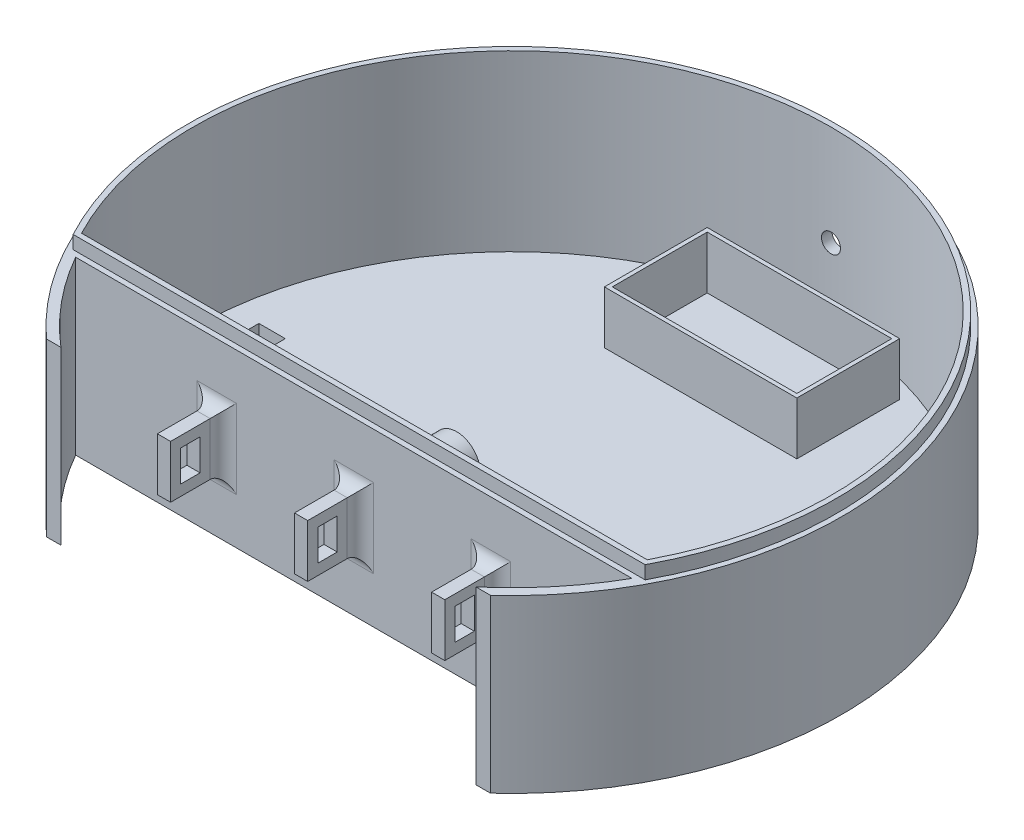
from build123d import *

# Parameters (mm, degrees)
RESSALTO_EXTRUS_O1_DEPTH   = 70
RESSALTO_EXTRUS_O4_START   = -70
RESSALTO_EXTRUS_O4_DEPTH   = 70
CASCA1_START               = 4
CASCA1_DEPTH               = 66
ESBO_O17_W                 = 10
ESBO_O17_H                 = 28
CORTE_EXTRUS_O2_DEPTH      = 10
CORTE_EXTRUS_O6_DEPTH      = 4
CORTE_EXTRUS_O6_DEPTH_BACK = 5
ESBO_O23_OUTSIDE_W         = 319.722
ESBO_O23_OUTSIDE_H         = 287.109
ESBO_O27_W                 = 5
ESBO_O27_H                 = 20
RESSALTO_EXTRUS_O5_DEPTH   = 20
FILETE2_R                  = 5
CORTE_EXTRUS_O7_DEPTH      = 104
CORTE_EXTRUS_O7_DEPTH_BACK = 5
ESBO_O28_W                 = 7.367994206
ESBO_O28_H                 = 11.845430552
ESBO_O32_R                 = 3.6
CORTE_EXTRUS_O8_DEPTH      = 187
ESBO_O32_3_R               = 9
ESBO_O32_3_R_2             = 3.6
RESSALTO_EXTRUS_O6_DEPTH   = 35
ESBO_O32_4_R               = 3.6
RESSALTO_EXTRUS_O7_DEPTH   = 6
FILETE3_R                  = 10
ESBO_O24_W                 = 73
ESBO_O24_H                 = 39
ESBO_O24_W_2               = 70
ESBO_O24_H_2               = 36
RESSALTO_EXTRUS_O8_DEPTH   = 20


# Read off the part's stored shape, not the designer's step: Casca1
with BuildPart() as part:
    # Esboço1 → Ressalto-extrusão1 (new body)
    with BuildSketch(Plane(origin=(0, 0, 0), x_dir=(1, 0, 0), z_dir=(0, 1, 0))):
        with BuildLine():
            ThreePointArc((125, 0), (-30.965140685, 121.103922572), (-109.658560997, -60))
            Line((-109.658560997, -60), (109.658560997, -60))
            ThreePointArc((109.658560997, -60), (121.103922572, -30.965140685), (125, 0))
        make_face()
    extrude(amount=RESSALTO_EXTRUS_O1_DEPTH)

    # Esboço5 → Ressalto-extrusão4 (add)
    with BuildSketch(Plane(origin=(0, 70, 0), x_dir=(1, 0, 0), z_dir=(0, 1, 0)).offset(RESSALTO_EXTRUS_O4_START)):
        with BuildLine():
            Line((-84.200220254, -92.386811338), (-78.700220254, -92.386811338))
            ThreePointArc((-78.700220254, -92.386811338), (-93.51006265, -77.362237302), (-105.49430116, -60))
            Line((-105.49430116, -60), (-109.658560997, -60))
            ThreePointArc((-109.658560997, -60), (-98.272748787, -77.249380877), (-84.200220254, -92.386811338))
        make_face()
        with BuildLine():
            Line((78.700220254, -92.386811338), (84.200220254, -92.386811338))
            ThreePointArc((84.200220254, -92.386811338), (98.272748787, -77.249380877), (109.658560997, -60))
            Line((109.658560997, -60), (105.49430116, -60))
            ThreePointArc((105.49430116, -60), (93.51006265, -77.362237302), (78.700220254, -92.386811338))
        make_face()
    extrude(amount=RESSALTO_EXTRUS_O4_DEPTH)

    # Casca1 outline → Casca1 (cut)
    with BuildSketch(Plane(origin=(0, 0, 0), x_dir=(1, 0, 0), z_dir=(0, 1, 0)).offset(CASCA1_START)):
        with BuildLine():
            Line((-107.261363034, -56), (107.261363034, -56))
            ThreePointArc((107.261363034, -56), (0, 121), (-107.261363034, -56))
        make_face()
    extrude(amount=CASCA1_DEPTH, mode=Mode.SUBTRACT)

    # Esboço17 → Corte-extrusão2 (cut)
    with BuildSketch(Plane(origin=(0, 4, 0), x_dir=(1, 0, 0), z_dir=(0, 1, 0))):
        with Locations((-105, 0)):
            Rectangle(ESBO_O17_W, ESBO_O17_H)
        with Locations((105, 0)):
            Rectangle(ESBO_O17_W, ESBO_O17_H)
    extrude(amount=-CORTE_EXTRUS_O2_DEPTH, mode=Mode.SUBTRACT)

    # Esboço23 outside → Corte-extrusão6 (cut, two sides: drawn at the far end of the back side and taken through both)
    with BuildSketch(Plane(origin=(0, 70, 0), x_dir=(1, 0, 0), z_dir=(0, 1, 0)).offset(-CORTE_EXTRUS_O6_DEPTH_BACK)):
        with Locations((0, 16.3065)):
            Rectangle(ESBO_O23_OUTSIDE_W, ESBO_O23_OUTSIDE_H)
        with BuildLine():
            Line((-108.466584716, -58), (108.466584716, -58))
            ThreePointArc((108.466584716, -58), (0, 123), (-108.466584716, -58))
        make_face(mode=Mode.SUBTRACT)
    extrude(amount=CORTE_EXTRUS_O6_DEPTH + CORTE_EXTRUS_O6_DEPTH_BACK, mode=Mode.SUBTRACT)

    # Esboço27 → Ressalto-extrusão5 (add)
    with BuildSketch(Plane.XY.offset(60)):
        with Locations((-52, 32.5)):
            Rectangle(ESBO_O27_W, ESBO_O27_H)
        with Locations((52, 32.5)):
            Rectangle(ESBO_O27_W, ESBO_O27_H)
        with Locations((0, 32.5)):
            Rectangle(ESBO_O27_W, ESBO_O27_H)
    extrude(amount=RESSALTO_EXTRUS_O5_DEPTH)

    # Filete2
    filete2_edges = [part.edges().sort_by_distance(p)[0] for p in [
        (-54.5, 32.5, 60),
        (-52, 22.5, 60),
        (-49.5, 32.5, 60),
        (-52, 42.5, 60),
        (49.5, 32.5, 60),
        (52, 22.5, 60),
        (54.5, 32.5, 60),
        (52, 42.5, 60),
        (-2.5, 32.5, 60),
        (0, 22.5, 60),
        (2.5, 32.5, 60),
        (0, 42.5, 60),
    ]]
    fillet(filete2_edges, radius=FILETE2_R)

    # Esboço28 → Corte-extrusão7 (cut, two sides: drawn at the far end of the back side and taken through both)
    with BuildSketch(Plane(origin=(-49.5, 0, 0), x_dir=(0, 0, -1), z_dir=(1, 0, 0)).offset(-CORTE_EXTRUS_O7_DEPTH_BACK)):
        with Locations((-72.5, 32.5)):
            Rectangle(ESBO_O28_W, ESBO_O28_H)
    extrude(amount=CORTE_EXTRUS_O7_DEPTH + CORTE_EXTRUS_O7_DEPTH_BACK, mode=Mode.SUBTRACT)

    # Esboço32 → Corte-extrusão8 (cut)
    with BuildSketch(Plane(origin=(0, 0, 56), x_dir=(-1, 0, 0), z_dir=(0, 0, -1))):
        with Locations(Location((0, 31.932833776, 0), (0, 0, 180))):
            Circle(ESBO_O32_R)
    extrude(amount=CORTE_EXTRUS_O8_DEPTH, mode=Mode.SUBTRACT)

    # Esboço32<3> → Ressalto-extrusão6 (add)
    with BuildSketch(Plane(origin=(0, 0, 56), x_dir=(-1, 0, 0), z_dir=(0, 0, -1))):
        with Locations((0, 31.932833776)):
            Circle(ESBO_O32_3_R)
        with Locations(Location((0, 31.932833776, 0), (0, 0, 180))):
            Circle(ESBO_O32_3_R_2, mode=Mode.SUBTRACT)
    extrude(amount=RESSALTO_EXTRUS_O6_DEPTH)

    # Esboço32<4> → Ressalto-extrusão7 (add)
    with BuildSketch(Plane(origin=(0, 0, 56), x_dir=(-1, 0, 0), z_dir=(0, 0, -1))):
        with Locations(Location((0, 31.932833776, 0), (0, 0, 180))):
            Circle(ESBO_O32_4_R)
    extrude(amount=RESSALTO_EXTRUS_O7_DEPTH)

    # Filete3
    filete3_edges = [part.edges().sort_by_distance(p)[0] for p in [
        (9, 31.932833776, 56),
    ]]
    fillet(filete3_edges, radius=FILETE3_R)

    # Esboço24 → Ressalto-extrusão8 (add)
    with BuildSketch(Plane(origin=(0, 4, 0), x_dir=(1, 0, 0), z_dir=(0, 1, 0))):
        with Locations((0, 91.008746076)):
            Rectangle(ESBO_O24_W, ESBO_O24_H)
        with Locations((0, 91.008746076)):
            Rectangle(ESBO_O24_W_2, ESBO_O24_H_2, mode=Mode.SUBTRACT)
    extrude(amount=RESSALTO_EXTRUS_O8_DEPTH)


solid = part.part
